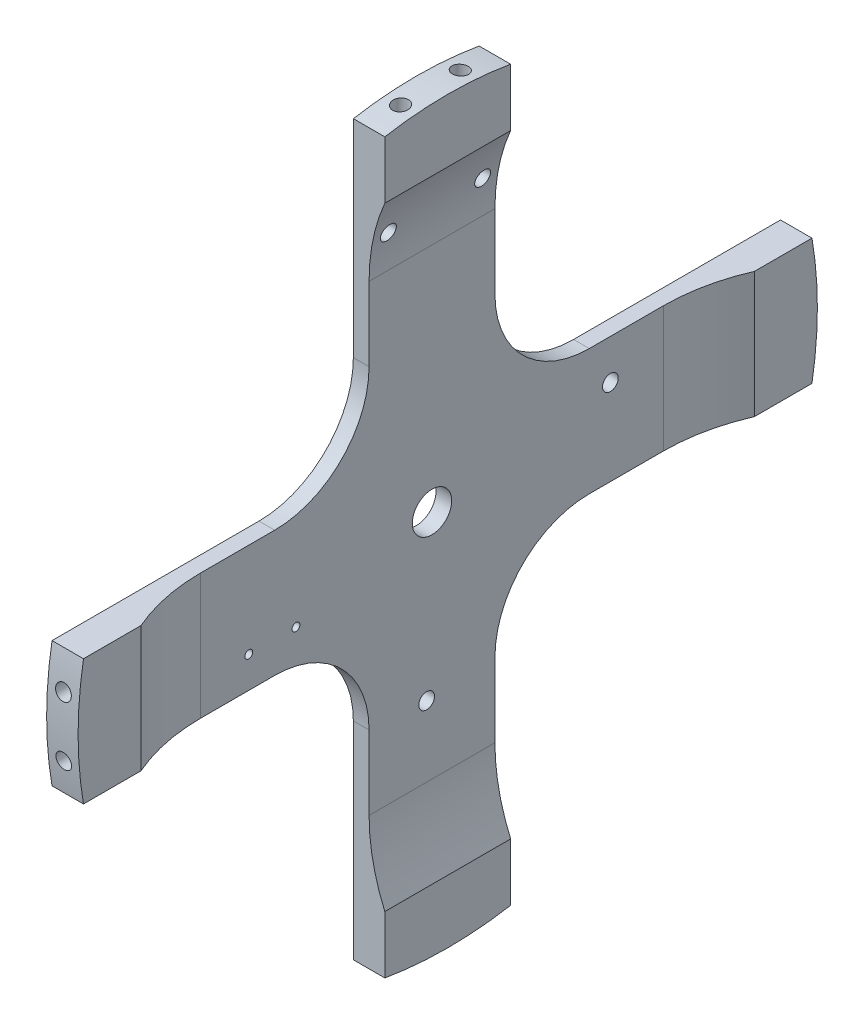
from build123d import *

# Parameters (mm, degrees)
BOSS_EXTRUDE1_DEPTH = 6.35
SKETCH2_W           = 23.222409447
SKETCH2_H           = 25.4
BOSS_EXTRUDE2_DEPTH = 12.7
FILLET1_R           = 38.1
FILLET2_R           = 76.2
SKETCH3_R           = 3.175
CUT_EXTRUDE1_DEPTH  = 12.7
CIRPATTERN1_COUNT   = 4
SKETCH4_R           = 1.5875
SKETCH4_R_2         = 3.175
CUT_EXTRUDE2_DEPTH  = 212.417812192
SKETCH5_R           = 3.175
CUT_EXTRUDE3_DEPTH  = 212.417812192


with BuildPart() as part:
    # Sketch1 → Boss-Extrude1 (new body)
    with BuildSketch(Plane(origin=(0, 0, 0), x_dir=(0, 0, -1), z_dir=(1, 0, 0))):
        with BuildLine():
            Line((-25.4, 25.4), (0, 25.4))
            Line((0, 25.4), (25.4, 25.4))
            Line((25.4, 25.4), (25.4, 147.047409447))
            ThreePointArc((25.4, 147.047409447), (0, 149.225), (-25.4, 147.047409447))
            Line((-25.4, 147.047409447), (-25.4, 25.4))
        make_face()
        with BuildLine():
            Line((25.4, 25.4), (25.4, 0))
            Line((25.4, 0), (25.4, -25.4))
            Line((25.4, -25.4), (147.047409447, -25.4))
            ThreePointArc((147.047409447, -25.4), (148.679605696, -12.746586804), (149.225, 0))
            ThreePointArc((149.225, 0), (148.679605696, 12.746586804), (147.047409447, 25.4))
            Line((147.047409447, 25.4), (25.4, 25.4))
        make_face()
        with BuildLine():
            Line((-25.4, -25.4), (-25.4, 0))
            Line((-25.4, 0), (-25.4, 25.4))
            Line((-25.4, 25.4), (-147.047409447, 25.4))
            ThreePointArc((-147.047409447, 25.4), (-149.225, 0), (-147.047409447, -25.4))
            Line((-147.047409447, -25.4), (-25.4, -25.4))
        make_face()
        with BuildLine():
            Line((0, -149.225), (0, -25.4))
            Line((0, -25.4), (-25.4, -25.4))
            Line((-25.4, -25.4), (-25.4, -147.047409447))
            ThreePointArc((-25.4, -147.047409447), (-12.746586804, -148.679605696), (0, -149.225))
        make_face()
        with BuildLine():
            Line((25.4, -25.4), (0, -25.4))
            Line((0, -25.4), (0, -149.225))
            ThreePointArc((0, -149.225), (12.746586804, -148.679605696), (25.4, -147.047409447))
            Line((25.4, -147.047409447), (25.4, -25.4))
        make_face()
        with BuildLine():
            ThreePointArc((7.9502, 0), (5.621640332, -5.621640332), (0, -7.9502))
            Line((0, -7.9502), (0, -25.4))
            Line((0, -25.4), (25.4, -25.4))
            Line((25.4, -25.4), (25.4, 0))
            Line((25.4, 0), (7.9502, 0))
        make_face()
        with BuildLine():
            Line((0, -25.4), (0, -7.9502))
            ThreePointArc((0, -7.9502), (-5.621640332, -5.621640332), (-7.9502, 0))
            Line((-7.9502, 0), (-25.4, 0))
            Line((-25.4, 0), (-25.4, -25.4))
            Line((-25.4, -25.4), (0, -25.4))
        make_face()
        with BuildLine():
            Line((-25.4, 0), (-7.9502, 0))
            ThreePointArc((-7.9502, 0), (-5.621640332, 5.621640332), (0, 7.9502))
            Line((0, 7.9502), (0, 25.4))
            Line((0, 25.4), (-25.4, 25.4))
            Line((-25.4, 25.4), (-25.4, 0))
        make_face()
        with BuildLine():
            ThreePointArc((0, 7.9502), (5.621640332, 5.621640332), (7.9502, 0))
            Line((7.9502, 0), (25.4, 0))
            Line((25.4, 0), (25.4, 25.4))
            Line((25.4, 25.4), (0, 25.4))
            Line((0, 25.4), (0, 7.9502))
        make_face()
    extrude(amount=BOSS_EXTRUDE1_DEPTH)

    # Sketch2 → Boss-Extrude2 (add)
    with BuildSketch(Plane.ZY):
        with BuildLine():
            Line((-25.4, 147.047409447), (-25.4, 123.825))
            Line((-25.4, 123.825), (0, 123.825))
            Line((0, 123.825), (25.4, 123.825))
            Line((25.4, 123.825), (25.4, 147.047409447))
            ThreePointArc((25.4, 147.047409447), (0, 149.225), (-25.4, 147.047409447))
        make_face()
        with BuildLine():
            Line((147.047409447, 25.4), (123.825, 25.4))
            Line((123.825, 25.4), (123.825, 0))
            Line((123.825, 0), (123.825, -25.4))
            Line((123.825, -25.4), (147.047409447, -25.4))
            ThreePointArc((147.047409447, -25.4), (149.225, 0), (147.047409447, 25.4))
        make_face()
        with BuildLine():
            Line((0, -123.825), (-25.4, -123.825))
            Line((-25.4, -123.825), (-25.4, -147.047409447))
            ThreePointArc((-25.4, -147.047409447), (0, -149.225), (25.4, -147.047409447))
            Line((25.4, -147.047409447), (25.4, -123.825))
            Line((25.4, -123.825), (0, -123.825))
        make_face()
        with Locations((-135.436204723, -12.7)):
            Rectangle(SKETCH2_W, SKETCH2_H)
        with BuildLine():
            Line((-147.047409447, 0), (-147.047409447, 25.4))
            ThreePointArc((-147.047409447, 25.4), (-148.679605696, 12.746586804), (-149.225, 0))
            Line((-149.225, 0), (-147.047409447, 0))
        make_face()
        with BuildLine():
            Line((-147.047409447, -25.4), (-147.047409447, 0))
            Line((-147.047409447, 0), (-149.225, 0))
            ThreePointArc((-149.225, 0), (-148.679605696, -12.746586804), (-147.047409447, -25.4))
        make_face()
        with Locations((-135.436204723, 12.7)):
            Rectangle(SKETCH2_W, SKETCH2_H)
        with BuildLine():
            Line((-147.047409447, 0), (-147.047409447, 25.4))
            ThreePointArc((-147.047409447, 25.4), (-148.679605696, 12.746586804), (-149.225, 0))
            Line((-149.225, 0), (-147.047409447, 0))
        make_face()
        with BuildLine():
            Line((-147.047409447, -25.4), (-147.047409447, 0))
            Line((-147.047409447, 0), (-149.225, 0))
            ThreePointArc((-149.225, 0), (-148.679605696, -12.746586804), (-147.047409447, -25.4))
        make_face()
    extrude(amount=-BOSS_EXTRUDE2_DEPTH)

    # Fillet1
    fillet1_edges = [part.edges().sort_by_distance(p)[0] for p in [
        (3.175, -25.4, 25.4),
        (3.175, 25.4, 25.4),
        (3.175, 25.4, -25.4),
        (3.175, -25.4, -25.4),
    ]]
    fillet(fillet1_edges, radius=FILLET1_R)

    # Fillet2
    # the kernel refuses this fillet: 76.2 mm, written as the material it adds along each edge
    with BuildSketch(Plane(origin=(6.35, -25.4, 123.825), x_dir=(0, 0, -1), z_dir=(0, 1, 0)), Plane(origin=(6.35, -123.825, -25.4), x_dir=(0, 1, 0), z_dir=(0, 0, 1)), Plane(origin=(6.35, 25.4, -123.825), x_dir=(0, 0, 1), z_dir=(0, -1, 0)), Plane(origin=(6.35, 123.825, 25.4), x_dir=(0, -1, 0), z_dir=(0, 0, -1))) as fillet2_piece_1:
        with BuildLine():
            CenterArc((30.453530173, -76.2), FILLET2_R, 90, 23.556464309)
            Line((0, -6.35), (-0.609070603, -4.953))
            ThreePointArc((-0.609070603, -4.953), (-1.524, -3.175), (-1.524, 0))
            Line((-1.524, 0), (0, 1.524))
            Line((0, 1.524), (30.453530173, 1.524))
            Line((30.453530173, 1.524), (30.453530173, 0))
        make_face()
    extrude(amount=50.8)

    # Sketch3 → Cut-Extrude1 (cut)
    with BuildSketch(Plane(origin=(0, 0, -149.225), x_dir=(-1, 0, 0), z_dir=(0, 0, -1))):
        with Locations((-6.35, 12.7)):
            Circle(SKETCH3_R)
        with Locations((-6.35, -11.43)):
            Circle(SKETCH3_R)
    cut_extrude1 = extrude(amount=-CUT_EXTRUDE1_DEPTH, mode=Mode.SUBTRACT)

    # CirPattern1: Cut-Extrude1 ×4 about axis
    cirpattern1_axis = Axis((0, 0, 0), (1, 0, 0))
    for i in range(1, CIRPATTERN1_COUNT):
        add(cut_extrude1.rotate(cirpattern1_axis, i * 360 / CIRPATTERN1_COUNT), mode=Mode.SUBTRACT)

    # Sketch4 → Cut-Extrude2 (cut, through all)
    with BuildSketch(Plane.ZY):
        with Locations((73.9775, -12.7635)):
            Circle(SKETCH4_R)
        with Locations((54.9275, -12.7635)):
            Circle(SKETCH4_R)
        with Locations((19.05, 107.95)):
            Circle(SKETCH4_R_2)
        with Locations((-19.05, 107.95)):
            Circle(SKETCH4_R_2)
    extrude(amount=-CUT_EXTRUDE2_DEPTH, mode=Mode.SUBTRACT)

    # Sketch5 → Cut-Extrude3 (cut, through all)
    with BuildSketch(Plane.ZY):
        with Locations((2.163404924, -64.900779229)):
            Circle(SKETCH5_R)
        with Locations((-72.013510637, 9.276136331)):
            Circle(SKETCH5_R)
    extrude(amount=-CUT_EXTRUDE3_DEPTH, mode=Mode.SUBTRACT)


solid = part.part
